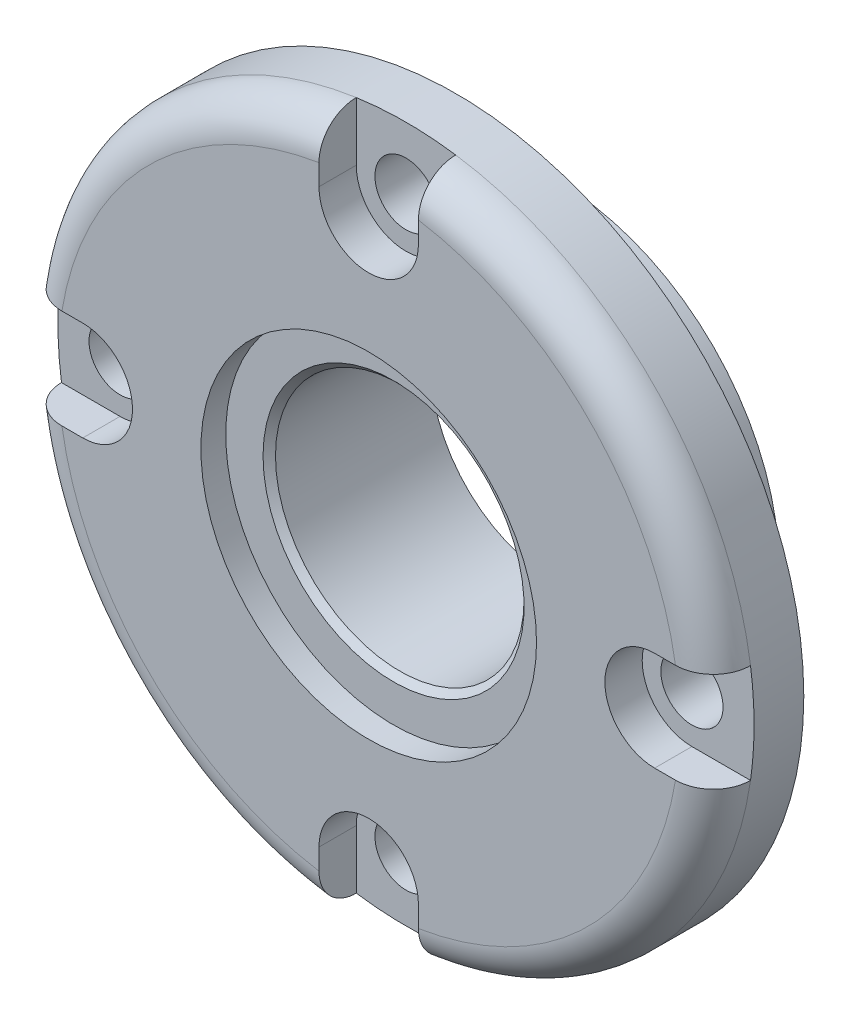
from build123d import *

# Parameters (mm, degrees)
FILLET1_R               = 3
CHAMFER1_SIZE           = 0.5
CUT_EXTRUDE2_START      = -3
CUT_EXTRUDE2_DEPTH      = 3
CUT_EXTRUDE3_DEPTH      = 43.343830719
CUT_EXTRUDE3_DEPTH_BACK = 43.343830719
SKETCH3_4_R             = 2.5


with BuildPart() as part:
    # Sketch2 → Revolve1 (revolve)
    with BuildSketch(Plane(origin=(0, 0, 0), x_dir=(-1, 0, 0), z_dir=(0, 1, 0))):
        Polygon((13.5, 7), (28, 7), (28, 0), (18, 0), (18, -8), (10, -8), (10, 5), (13.5, 5), align=None)
    revolve(axis=Axis((0, 0, 28.029292285), (0, 0, -1)))

    # Fillet1
    fillet1_edges = [part.edges().sort_by_distance(p)[0] for p in [
        (28, 0, 7),
    ]]
    fillet(fillet1_edges, radius=FILLET1_R)

    # Chamfer1
    chamfer1_edges = [part.edges().sort_by_distance(p)[0] for p in [
        (10, 0, 5),
    ]]
    chamfer(chamfer1_edges, length=CHAMFER1_SIZE)

    # Sketch3 → Cut-Extrude2 (cut)
    with BuildSketch(Plane.XY.offset(7).offset(CUT_EXTRUDE2_START)):
        with BuildLine():
            ThreePointArc((-4, 23), (0, 19), (4, 23))
            Line((4, 23), (4, 27.712812921))
            ThreePointArc((4, 27.712812921), (0, 28), (-4, 27.712812921))
            Line((-4, 27.712812921), (-4, 23))
        make_face()
        with BuildLine():
            Line((-27.712812921, -4), (-23, -4))
            ThreePointArc((-23, -4), (-19, 0), (-23, 4))
            Line((-23, 4), (-27.712812921, 4))
            ThreePointArc((-27.712812921, 4), (-28, 0), (-27.712812921, -4))
        make_face()
        with BuildLine():
            Line((23, -4), (27.712812921, -4))
            ThreePointArc((27.712812921, -4), (28, 0), (27.712812921, 4))
            Line((27.712812921, 4), (23, 4))
            ThreePointArc((23, 4), (19, 0), (23, -4))
        make_face()
        with BuildLine():
            Line((4, -27.712812921), (4, -23))
            ThreePointArc((4, -23), (0, -19), (-4, -23))
            Line((-4, -23), (-4, -27.712812921))
            ThreePointArc((-4, -27.712812921), (0, -28), (4, -27.712812921))
        make_face()
    extrude(amount=CUT_EXTRUDE2_DEPTH, mode=Mode.SUBTRACT)

    # Sketch3<4> → Cut-Extrude3 (cut, two sides: drawn at the far end of the back side and taken through both)
    with BuildSketch(Plane.XY.offset(7).offset(-CUT_EXTRUDE3_DEPTH_BACK)):
        with Locations((0, 23)):
            Circle(SKETCH3_4_R)
        with Locations((-23, 0)):
            Circle(SKETCH3_4_R)
        with Locations((23, 0)):
            Circle(SKETCH3_4_R)
        with Locations((0, -23)):
            Circle(SKETCH3_4_R)
    extrude(amount=CUT_EXTRUDE3_DEPTH + CUT_EXTRUDE3_DEPTH_BACK, mode=Mode.SUBTRACT)


solid = part.part
